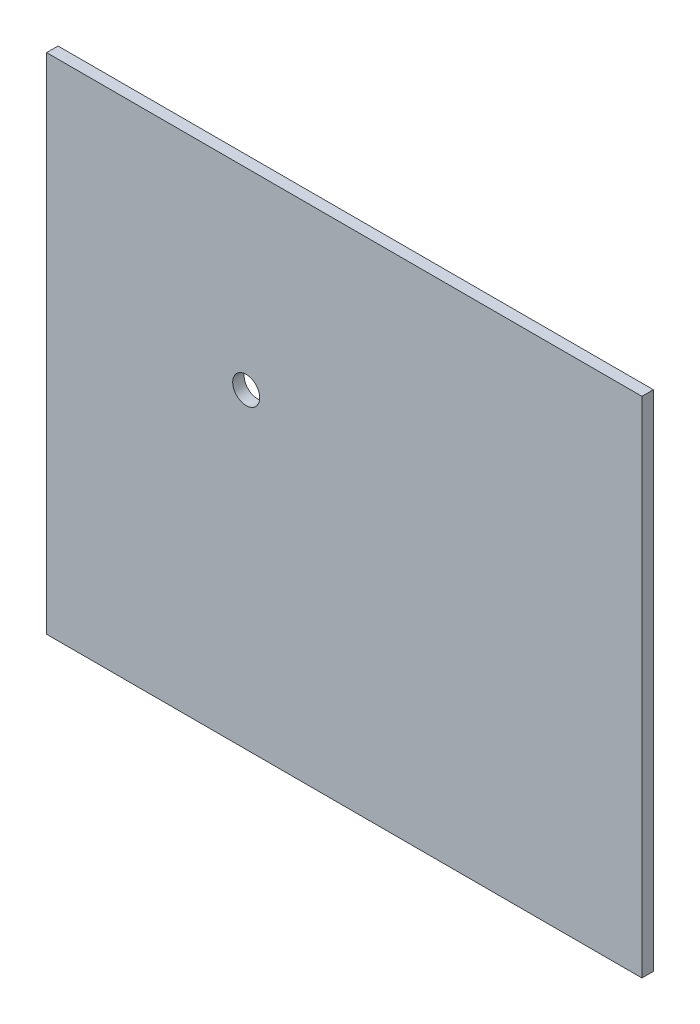
from build123d import *

# Parameters (mm, degrees)
SKETCH1_W             = 330.2
SKETCH1_H             = 279.4
BOSS_EXTRUDE1_DEPTH   = 3.175
M14_CLEARANCE_HOLE1_D = 15


with BuildPart() as part:
    # Sketch1 → Boss-Extrude1 (new, symmetric)
    with BuildSketch(Plane.XY):
        Rectangle(SKETCH1_W, SKETCH1_H)
    extrude(amount=BOSS_EXTRUDE1_DEPTH, both=True)

    # M14 Clearance Hole1 (through all)
    with Locations(Plane.XY.offset(3.175)):
        with Locations((-54.39380265, 32.998958606)):
            Hole(M14_CLEARANCE_HOLE1_D / 2)


solid = part.part
